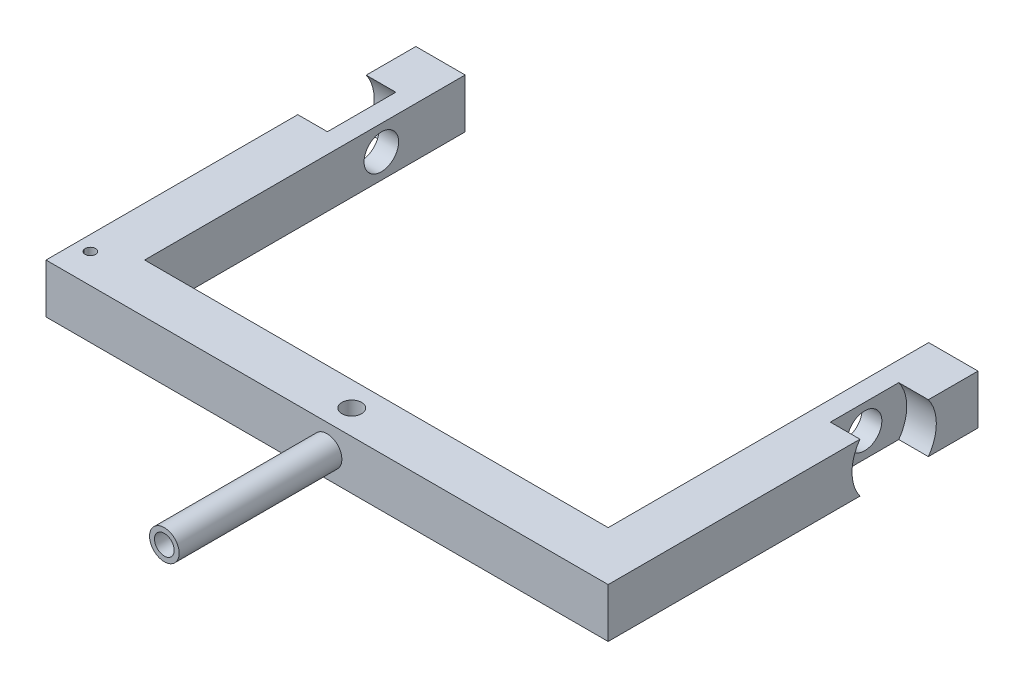
from build123d import *

# Parameters (mm, degrees)
BOSS_EXTRUDE1_DEPTH = 10
SKETCH2_R           = 8.55
CUT_EXTRUDE1_DEPTH  = 6
SKETCH3_R           = 3.5
CUT_EXTRUDE2_DEPTH  = 127.447617613
SKETCH4_R           = 3
BOSS_EXTRUDE2_DEPTH = 33
SKETCH5_R           = 1.05
CUT_EXTRUDE3_DEPTH  = 88.028730888
SKETCH6_R           = 2
CUT_EXTRUDE4_DEPTH  = 38
SKETCH7_R           = 2
CUT_EXTRUDE5_DEPTH  = 5
FILLET2_R           = 6


with BuildPart() as part:
    # Sketch1 → Boss-Extrude1 (new body)
    with BuildSketch(Plane(origin=(0, 0, 0), x_dir=(1, 0, 0), z_dir=(0, 1, 0))):
        Polygon((-47, 0), (47, 0), (47, 65), (57, 65), (57, -10), (-57, -10), (-57, 65), (-47, 65), align=None)
    extrude(amount=BOSS_EXTRUDE1_DEPTH)

    # Sketch2 → Cut-Extrude1 (cut)
    with BuildSketch(Plane(origin=(57, 0, 0), x_dir=(0, 0, -1), z_dir=(1, 0, 0))):
        with Locations((48, 5)):
            Circle(SKETCH2_R)
    cut_extrude1 = extrude(amount=-CUT_EXTRUDE1_DEPTH, mode=Mode.SUBTRACT)

    # Mirror1: Cut-Extrude1 across plane
    add(cut_extrude1.mirror(Plane(origin=(0, 0, 0), x_dir=(0, 0, 1), z_dir=(1, 0, 0))), mode=Mode.SUBTRACT)

    # Sketch3 → Cut-Extrude2 (cut, through all)
    with BuildSketch(Plane(origin=(51, 0, 0), x_dir=(0, 0, -1), z_dir=(1, 0, 0))):
        with Locations(Location((48, 5, 0), (0, 0, 180))):
            Circle(SKETCH3_R)
    extrude(amount=-CUT_EXTRUDE2_DEPTH, mode=Mode.SUBTRACT)

    # Sketch4 → Boss-Extrude2 (add)
    with BuildSketch(Plane.XY.offset(10)):
        with Locations(Location((0, 5, 0), (0, 0, 180))):
            Circle(SKETCH4_R)
    extrude(amount=BOSS_EXTRUDE2_DEPTH)

    # Sketch5 → Cut-Extrude3 (cut, through all)
    with BuildSketch(Plane(origin=(0, 10, 0), x_dir=(1, 0, 0), z_dir=(0, 1, 0))):
        with Locations(Location((-54, -4, 0), (0, 0, 270))):
            Circle(SKETCH5_R)
    extrude(amount=-CUT_EXTRUDE3_DEPTH, mode=Mode.SUBTRACT)

    # Sketch6 → Cut-Extrude4 (cut)
    with BuildSketch(Plane.XY.offset(43)):
        with Locations((0, 5)):
            Circle(SKETCH6_R)
    extrude(amount=-CUT_EXTRUDE4_DEPTH, mode=Mode.SUBTRACT)

    # Sketch7 → Cut-Extrude5 (cut)
    with BuildSketch(Plane(origin=(0, 10, 0), x_dir=(1, 0, 0), z_dir=(0, 1, 0))):
        with Locations(Location((0, -5, 0), (0, 0, 270))):
            Circle(SKETCH7_R)
    extrude(amount=-CUT_EXTRUDE5_DEPTH, mode=Mode.SUBTRACT)

    # Fillet2
    # the kernel refuses this fillet: 6 mm, written as the material it takes off along each edge
    with BuildSketch(Plane(origin=(17, 5, 5), x_dir=(0, 0, -1), z_dir=(-1, 0, 0))) as fillet2_piece_1_section:
        with BuildLine():
            CenterArc((FILLET2_R, FILLET2_R), FILLET2_R, 180, 90)
            Line((0, FILLET2_R), (0, 0))
            Line((0, 0), (FILLET2_R, 0))
        make_face()
    fillet2_piece_1 = extrude(amount=34, mode=Mode.PRIVATE)
    fillet2_piece_1 = fillet2_piece_1 & Plane(origin=(0, 4.127189323, 5), x_dir=(0, 0, 1), z_dir=(0, 1, 0)) * Cylinder(2, 92, mode=Mode.PRIVATE)
    fillet2_piece_1 = fillet2_piece_1 & Plane(origin=(0, 5, 4.127189323), x_dir=(1, 0, 0), z_dir=(0, 0, 1)) * Cylinder(2, 92, mode=Mode.PRIVATE)
    add(fillet2_piece_1, mode=Mode.SUBTRACT)


solid = part.part
